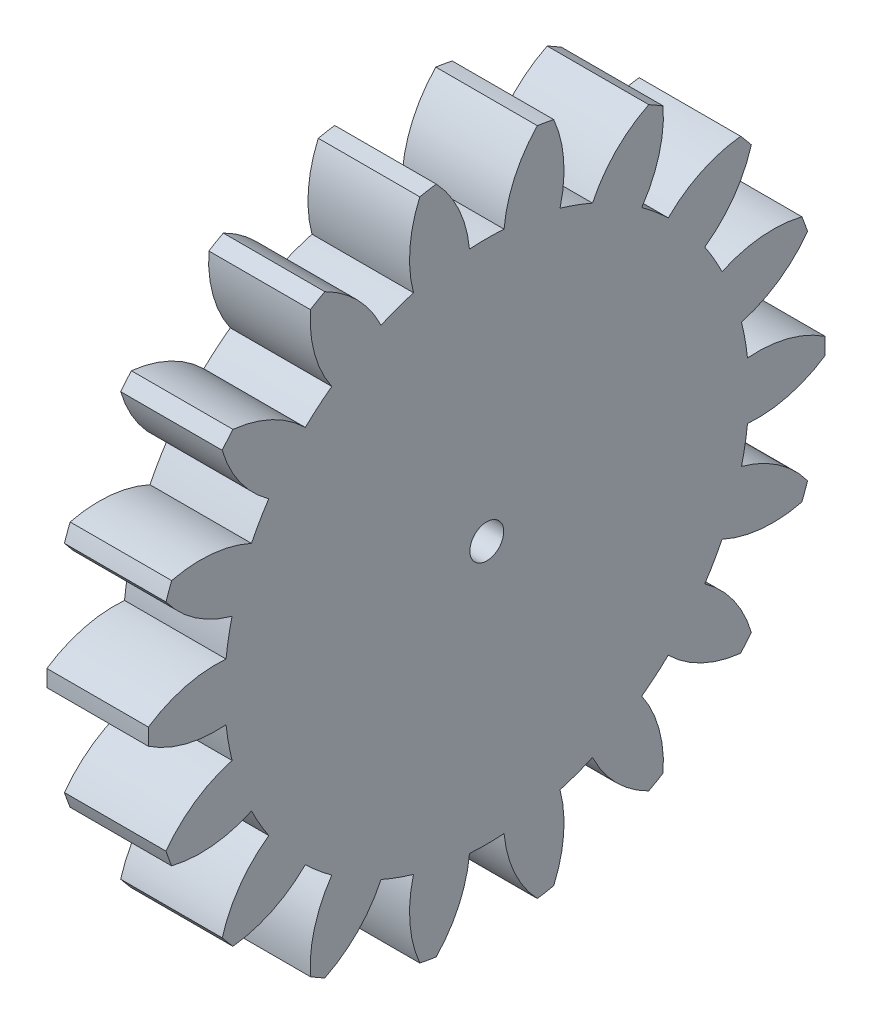
from build123d import *

# Parameters (mm, degrees)
BASPROSKE_W     = 3
BASPROSKE_H     = 10
TOOTHCUT_DEPTH  = 15.456832295
TEETHCUTS_COUNT = 18
TEETHCUTS_ANGLE = 340
BORSKE_R        = 0.5
BORE_DEPTH      = 50.0000508


with BuildPart() as part:
    # BasProSke → Base-Revolve (revolve)
    with BuildSketch(Plane(origin=(0, 0, 0), x_dir=(1, 0, 0), z_dir=(0, 1, 0))):
        with Locations((1.5, 5)):
            Rectangle(BASPROSKE_W, BASPROSKE_H)
    revolve(axis=Axis((-10, 0, 0), (1, 0, 0)))

    # TooCutSke → ToothCut (cut, through all)
    with BuildSketch(Plane(origin=(0, 0, 0), x_dir=(0, 0, -1), z_dir=(1, 0, 0))):
        with BuildLine():
            ThreePointArc((0.510641536, 7.732156635), (0, 7.749), (-0.510641536, 7.732156635))
            ThreePointArc((-0.510641536, 7.732156635), (-0.82619259, 8.907320741), (-1.515208602, 9.910236529))
            ThreePointArc((-1.515208602, 9.910236529), (0, 10.0254), (1.515208602, 9.910236529))
            ThreePointArc((1.515208602, 9.910236529), (0.82619259, 8.907320741), (0.510641536, 7.732156635))
        make_face()
    toothcut = extrude(amount=TOOTHCUT_DEPTH, mode=Mode.SUBTRACT)

    # TeethCuts: ToothCut ×18 about axis
    teethcuts_axis = Axis((-10, 0, 0), (1, 0, 0))
    for i in range(1, TEETHCUTS_COUNT):
        add(toothcut.rotate(teethcuts_axis, i * TEETHCUTS_ANGLE / (TEETHCUTS_COUNT - 1)), mode=Mode.SUBTRACT)

    # BorSke → Bore (cut, symmetric)
    with BuildSketch(Plane(origin=(0, 0, 0), x_dir=(0, 0, -1), z_dir=(1, 0, 0))):
        Circle(BORSKE_R)
    extrude(amount=BORE_DEPTH, both=True, mode=Mode.SUBTRACT)


solid = part.part
